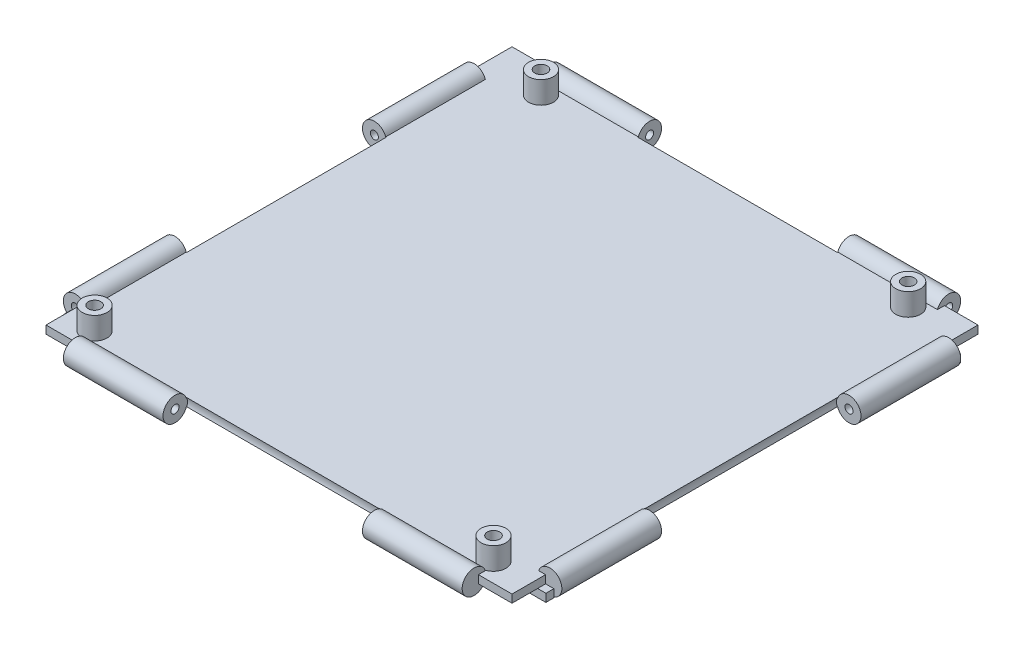
from build123d import *

# Parameters (mm, degrees)
SKETCH3_W                 = 97
SKETCH3_H                 = 97
BOSS_EXTRUDE2_DEPTH       = 1.6
SKETCH6_R                 = 2.4
BOSS_EXTRUDE3_DEPTH       = 25
SKETCH8_R                 = 2.4
BOSS_EXTRUDE4_DEPTH       = 25
BOSS_EXTRUDE5_START       = -25
SKETCH10_R                = 2.4
BOSS_EXTRUDE5_DEPTH       = 25
BOSS_EXTRUDE6_START       = -25
SKETCH11_R                = 2.4
BOSS_EXTRUDE6_DEPTH       = 25
SKETCH12_R                = 2.4
BOSS_EXTRUDE7_DEPTH       = 25
SKETCH13_R                = 2.4
BOSS_EXTRUDE8_DEPTH       = 25
BOSS_EXTRUDE9_START       = -25
SKETCH15_R                = 2.4
BOSS_EXTRUDE9_DEPTH       = 25
BOSS_EXTRUDE10_START      = -25
SKETCH16_R                = 2.4
BOSS_EXTRUDE10_DEPTH      = 25
SKETCH24_W                = 4.8
SKETCH24_H                = 5.548100674
CUT_EXTRUDE6_DEPTH        = 3.3
SKETCH25_W                = 4.8
SKETCH25_H                = 4.8
CUT_EXTRUDE7_DEPTH        = 3.3
SKETCH27_W                = 4.8
SKETCH27_H                = 5.15761508
CUT_EXTRUDE8_DEPTH        = 3.3
SKETCH28_W                = 4.8
SKETCH28_H                = 4.8
CUT_EXTRUDE9_DEPTH        = 6
SKETCH29_W                = 4.8
SKETCH29_H                = 5.426654508
CUT_EXTRUDE10_DEPTH       = 3.3
SKETCH30_W                = 5.09884484
SKETCH30_H                = 4.8
CUT_EXTRUDE11_DEPTH       = 3.3
SKETCH31_W                = 4.8
SKETCH31_H                = 5.480877926
CUT_EXTRUDE12_DEPTH       = 3.3
SKETCH32_W                = 4.987524697
SKETCH32_H                = 4.8
CUT_EXTRUDE13_DEPTH       = 3.3
BOSS_EXTRUDE11_START      = 1
SKETCH38_R                = 2.4
BOSS_EXTRUDE11_DEPTH      = 1
SKETCH39_R                = 2.4
BOSS_EXTRUDE12_DEPTH      = 1
BOSS_EXTRUDE13_START      = 1
SKETCH42_R                = 2.4
BOSS_EXTRUDE13_DEPTH      = 1
SKETCH43_R                = 2.4
BOSS_EXTRUDE14_DEPTH      = 1
BOSS_EXTRUDE15_START      = 1
SKETCH44_R                = 2.4
BOSS_EXTRUDE15_DEPTH      = 1
SKETCH45_R                = 2.4
BOSS_EXTRUDE16_DEPTH      = 1
BOSS_EXTRUDE17_START      = 1
SKETCH46_R                = 2.4
BOSS_EXTRUDE17_DEPTH      = 1
SKETCH47_R                = 2.4
BOSS_EXTRUDE18_DEPTH      = 1
CUT_EXTRUDE24_DEPTH       = 5.2
CUT_EXTRUDE25_DEPTH       = 5.2
CUT_EXTRUDE26_DEPTH       = 5.2
CUT_EXTRUDE27_DEPTH       = 5.2
CUT_EXTRUDE29_DEPTH       = 5.2
CUT_EXTRUDE30_DEPTH       = 5.2
CUT_EXTRUDE31_DEPTH       = 5.2
CUT_EXTRUDE32_DEPTH       = 5.2
SKETCH81_W                = 1.5372583
SKETCH81_H                = 1.5372583
BOSS_EXTRUDE21_DEPTH      = 1.6
SKETCH82_W                = 1.5372583
SKETCH82_H                = 1.5372583
BOSS_EXTRUDE22_DEPTH      = 1.6
SKETCH83_W                = 1.5372583
SKETCH83_H                = 1.5372583
BOSS_EXTRUDE23_DEPTH      = 1.6
SKETCH84_W                = 1.5372583
SKETCH84_H                = 1.5372583
BOSS_EXTRUDE24_DEPTH      = 1.6
SKETCH87_R                = 2.4
BOSS_EXTRUDE25_DEPTH      = 2.5
BOSS_EXTRUDE26_START      = 2.5
SKETCH88_R                = 2.4
BOSS_EXTRUDE26_DEPTH      = 2.5
SKETCH91_R                = 2.5
CUT_EXTRUDE33_DEPTH       = 40
BOSS_EXTRUDE27_START      = 2.5
SKETCH93_R                = 2.4
BOSS_EXTRUDE27_DEPTH      = 2.5
SKETCH94_R                = 2.4
BOSS_EXTRUDE28_DEPTH      = 2.5
SKETCH97_R                = 2.5
CUT_EXTRUDE34_DEPTH       = 40
BOSS_EXTRUDE29_START      = 2.5
SKETCH98_R                = 2.4
BOSS_EXTRUDE29_DEPTH      = 2.5
SKETCH99_R                = 2.4
BOSS_EXTRUDE30_DEPTH      = 2.5
SKETCH100_R               = 2.5
CUT_EXTRUDE35_DEPTH       = 40
SKETCH101_R               = 2.4
BOSS_EXTRUDE31_DEPTH      = 2.5
BOSS_EXTRUDE32_START      = 2.5
SKETCH102_R               = 2.4
BOSS_EXTRUDE32_DEPTH      = 2.5
SKETCH104_R               = 2.5
CUT_EXTRUDE36_DEPTH       = 40
SKETCH105_R               = 0.81
CUT_EXTRUDE37_DEPTH       = 78.5
SKETCH106_R               = 0.81
CUT_EXTRUDE38_DEPTH       = 78.5
SKETCH107_R               = 0.81
CUT_EXTRUDE39_DEPTH       = 78.5
SKETCH108_R               = 0.81
CUT_EXTRUDE40_DEPTH       = 78.5
CUT_EXTRUDE47_DEPTH       = 20
CUT_EXTRUDE48_DEPTH       = 20
CUT_EXTRUDE49_DEPTH       = 20
CUT_EXTRUDE50_DEPTH       = 20
SKETCH139_R               = 15
BOSS_EXTRUDE40_DEPTH      = 1.6
SKETCH140_R               = 5
CUT_EXTRUDE51_DEPTH       = 1.6
FILLET7_R                 = 2
CUT_EXTRUDE41_DEPTH       = 1.6
CUT_EXTRUDE42_DEPTH       = 1.6
CUT_EXTRUDE43_DEPTH       = 1.6
CUT_EXTRUDE44_DEPTH       = 1.6
SKETCH123_R               = 15
BOSS_EXTRUDE35_DEPTH      = 1.6
SKETCH124_R               = 5
CUT_EXTRUDE45_DEPTH       = 1.6
FILLET4_R                 = 2
SKETCH144_W               = 6.7372583
SKETCH144_H               = 1.6
BOSS_EXTRUDE42_DEPTH      = 1.6
SKETCH145_W               = 8.3372583
SKETCH145_H               = 1.6
BOSS_EXTRUDE43_DEPTH      = 1.6
SKETCH147_W               = 8.4
SKETCH147_H               = 1.6
BOSS_EXTRUDE44_DEPTH      = 1.6
SKETCH149_W               = 8.4
SKETCH149_H               = 1.6
BOSS_EXTRUDE45_DEPTH      = 1.6
SKETCH150_W               = 8.4
SKETCH150_H               = 1.6
BOSS_EXTRUDE46_DEPTH      = 1.6
SKETCH151_W               = 8.4
SKETCH151_H               = 1.6
BOSS_EXTRUDE47_DEPTH      = 1.6
FILLET12_R                = 1
SKETCH176_W               = 84.989213742
SKETCH176_H               = 89.710836726
BOSS_EXTRUDE58_DEPTH      = 1.6
SKETCH177_R               = 2.5
BOSS_EXTRUDE59_DEPTH      = 4.45
M3X0_5_TAPPED_HOLE1_D     = 2.5
M3X0_5_TAPPED_HOLE1_DEPTH = 4.45
M3X0_5_TAPPED_HOLE1_TIP   = 0.751075774


with BuildPart() as part:
    # Sketch3 → Boss-Extrude2 (new body)
    with BuildSketch(Plane(origin=(0, 0, 0), x_dir=(1, 0, 0), z_dir=(0, 1, 0))):
        Rectangle(SKETCH3_W, SKETCH3_H)
    extrude(amount=BOSS_EXTRUDE2_DEPTH)

    # Sketch6 → Boss-Extrude3 (add)
    with BuildSketch(Plane.XY.offset(48.5)):
        with Locations((-47.6, 0.8)):
            Circle(SKETCH6_R)
    extrude(amount=-BOSS_EXTRUDE3_DEPTH)

    # Sketch8 → Boss-Extrude4 (add)
    with BuildSketch(Plane.XY.offset(48.5)):
        with Locations((47.6, 0.8)):
            Circle(SKETCH8_R)
    extrude(amount=-BOSS_EXTRUDE4_DEPTH)

    # Sketch10 → Boss-Extrude5 (add)
    with BuildSketch(Plane(origin=(0, 0, -48.5), x_dir=(-1, 0, 0), z_dir=(0, 0, -1)).offset(BOSS_EXTRUDE5_START)):
        with Locations((-47.6, 0.8)):
            Circle(SKETCH10_R)
    extrude(amount=BOSS_EXTRUDE5_DEPTH)

    # Sketch11 → Boss-Extrude6 (add)
    with BuildSketch(Plane(origin=(0, 0, -48.5), x_dir=(-1, 0, 0), z_dir=(0, 0, -1)).offset(BOSS_EXTRUDE6_START)):
        with Locations((47.6, 0.8)):
            Circle(SKETCH11_R)
    extrude(amount=BOSS_EXTRUDE6_DEPTH)

    # Sketch12 → Boss-Extrude7 (add)
    with BuildSketch(Plane.ZY.offset(48.5)):
        with Locations((-47.6, 0.8)):
            Circle(SKETCH12_R)
    extrude(amount=-BOSS_EXTRUDE7_DEPTH)

    # Sketch13 → Boss-Extrude8 (add)
    with BuildSketch(Plane.ZY.offset(48.5)):
        with Locations((47.6, 0.8)):
            Circle(SKETCH13_R)
    extrude(amount=-BOSS_EXTRUDE8_DEPTH)

    # Sketch15 → Boss-Extrude9 (add)
    with BuildSketch(Plane(origin=(48.5, 0, 0), x_dir=(0, 0, -1), z_dir=(1, 0, 0)).offset(BOSS_EXTRUDE9_START)):
        with Locations((-47.6, 0.8)):
            Circle(SKETCH15_R)
    extrude(amount=BOSS_EXTRUDE9_DEPTH)

    # Sketch16 → Boss-Extrude10 (add)
    with BuildSketch(Plane(origin=(48.5, 0, 0), x_dir=(0, 0, -1), z_dir=(1, 0, 0)).offset(BOSS_EXTRUDE10_START)):
        with Locations((47.6, 0.8)):
            Circle(SKETCH16_R)
    extrude(amount=BOSS_EXTRUDE10_DEPTH)

    # Sketch24 → Cut-Extrude6 (cut)
    with BuildSketch(Plane.XY.offset(48.5)):
        with Locations((-47.6, 0.8)):
            Rectangle(SKETCH24_W, SKETCH24_H)
    extrude(amount=-CUT_EXTRUDE6_DEPTH, mode=Mode.SUBTRACT)

    # Sketch25 → Cut-Extrude7 (cut)
    with BuildSketch(Plane(origin=(0, 0, 48.5), x_dir=(-1, 0, 0), z_dir=(0, 0, -1))):
        with Locations((47.6, 0.8)):
            Rectangle(SKETCH25_W, SKETCH25_H)
    extrude(amount=-CUT_EXTRUDE7_DEPTH, mode=Mode.SUBTRACT)

    # Sketch27 → Cut-Extrude8 (cut)
    with BuildSketch(Plane(origin=(0, 0, -48.5), x_dir=(-1, 0, 0), z_dir=(0, 0, -1))):
        with Locations((47.6, 0.8)):
            Rectangle(SKETCH27_W, SKETCH27_H)
    extrude(amount=-CUT_EXTRUDE8_DEPTH, mode=Mode.SUBTRACT)

    # Sketch28 → Cut-Extrude9 (cut)
    with BuildSketch(Plane(origin=(0, 0, -45.2), x_dir=(-1, 0, 0), z_dir=(0, 0, -1))):
        with Locations((47.6, 0.8)):
            Rectangle(SKETCH28_W, SKETCH28_H)
    extrude(amount=CUT_EXTRUDE9_DEPTH, mode=Mode.SUBTRACT)

    # Sketch29 → Cut-Extrude10 (cut)
    with BuildSketch(Plane.XY.offset(48.5)):
        with Locations((47.6, 0.8)):
            Rectangle(SKETCH29_W, SKETCH29_H)
    extrude(amount=-CUT_EXTRUDE10_DEPTH, mode=Mode.SUBTRACT)

    # Sketch30 → Cut-Extrude11 (cut)
    with BuildSketch(Plane(origin=(0, 0, 48.5), x_dir=(-1, 0, 0), z_dir=(0, 0, -1))):
        with Locations((-47.74942242, 0.8)):
            Rectangle(SKETCH30_W, SKETCH30_H)
    extrude(amount=-CUT_EXTRUDE11_DEPTH, mode=Mode.SUBTRACT)

    # Sketch31 → Cut-Extrude12 (cut)
    with BuildSketch(Plane(origin=(0, 0, -48.5), x_dir=(-1, 0, 0), z_dir=(0, 0, -1))):
        with Locations((-47.6, 0.8)):
            Rectangle(SKETCH31_W, SKETCH31_H)
    extrude(amount=-CUT_EXTRUDE12_DEPTH, mode=Mode.SUBTRACT)

    # Sketch32 → Cut-Extrude13 (cut)
    with BuildSketch(Plane.XY.offset(-48.5)):
        with Locations((47.693762349, 0.8)):
            Rectangle(SKETCH32_W, SKETCH32_H)
    extrude(amount=-CUT_EXTRUDE13_DEPTH, mode=Mode.SUBTRACT)

    # Sketch38 → Boss-Extrude11 (add)
    with BuildSketch(Plane.XY.offset(-23.5).offset(BOSS_EXTRUDE11_START)):
        with Locations((-47.6, 0.8)):
            Circle(SKETCH38_R)
    extrude(amount=-BOSS_EXTRUDE11_DEPTH)

    # Sketch39 → Boss-Extrude12 (add)
    with BuildSketch(Plane(origin=(0, 0, 23.5), x_dir=(-1, 0, 0), z_dir=(0, 0, -1))):
        with Locations((47.6, 0.8)):
            Circle(SKETCH39_R)
    extrude(amount=BOSS_EXTRUDE12_DEPTH)

    # Sketch42 → Boss-Extrude13 (add)
    with BuildSketch(Plane.XY.offset(-23.5).offset(BOSS_EXTRUDE13_START)):
        with Locations((47.6, 0.8)):
            Circle(SKETCH42_R)
    extrude(amount=-BOSS_EXTRUDE13_DEPTH)

    # Sketch43 → Boss-Extrude14 (add)
    with BuildSketch(Plane(origin=(0, 0, 23.5), x_dir=(-1, 0, 0), z_dir=(0, 0, -1))):
        with Locations((-47.6, 0.8)):
            Circle(SKETCH43_R)
    extrude(amount=BOSS_EXTRUDE14_DEPTH)

    # Sketch44 → Boss-Extrude15 (add)
    with BuildSketch(Plane.ZY.offset(-23.5).offset(BOSS_EXTRUDE15_START)):
        with Locations((-47.6, 0.8)):
            Circle(SKETCH44_R)
    extrude(amount=-BOSS_EXTRUDE15_DEPTH)

    # Sketch45 → Boss-Extrude16 (add)
    with BuildSketch(Plane(origin=(-23.5, 0, 0), x_dir=(0, 0, -1), z_dir=(1, 0, 0))):
        with Locations((47.6, 0.8)):
            Circle(SKETCH45_R)
    extrude(amount=BOSS_EXTRUDE16_DEPTH)

    # Sketch46 → Boss-Extrude17 (add)
    with BuildSketch(Plane.ZY.offset(-23.5).offset(BOSS_EXTRUDE17_START)):
        with Locations((47.6, 0.8)):
            Circle(SKETCH46_R)
    extrude(amount=-BOSS_EXTRUDE17_DEPTH)

    # Sketch47 → Boss-Extrude18 (add)
    with BuildSketch(Plane(origin=(-23.5, 0, 0), x_dir=(0, 0, -1), z_dir=(1, 0, 0))):
        with Locations((-47.6, 0.8)):
            Circle(SKETCH47_R)
    extrude(amount=BOSS_EXTRUDE18_DEPTH)

    # Sketch69 → Cut-Extrude24 (cut)
    with BuildSketch(Plane.XY.offset(45.2)):
        Polygon((-45.3372583, 1.6), (-46.7372583, 1.6), (-46.7372583, 0), (-45.3372583, 0), (-45.3372583, -2.296346165), (-50.861781819, -2.296346165), (-50.861781819, 4.089099576), (-45.3372583, 4.089099576), align=None)
    extrude(amount=-CUT_EXTRUDE24_DEPTH, mode=Mode.SUBTRACT)

    # Sketch72 → Cut-Extrude25 (cut)
    with BuildSketch(Plane.XY.offset(45.2)):
        Polygon((45.3372583, 1.6), (46.7372583, 1.6), (46.7372583, 0), (45.3372583, 0), (45.3372583, -2.331961344), (51.56640404, -2.331961344), (51.56640404, 3.886760814), (45.3372583, 3.886760814), align=None)
    extrude(amount=-CUT_EXTRUDE25_DEPTH, mode=Mode.SUBTRACT)

    # Sketch74 → Cut-Extrude26 (cut)
    with BuildSketch(Plane(origin=(0, 0, -45.2), x_dir=(-1, 0, 0), z_dir=(0, 0, -1))):
        Polygon((-45.3372583, 1.6), (-46.7372583, 1.6), (-46.7372583, 0), (-45.3372583, 0), (-45.3372583, -2.152541816), (-50.402223677, -2.152541816), (-50.402223677, 3.951890312), (-45.3372583, 3.951890312), align=None)
    extrude(amount=-CUT_EXTRUDE26_DEPTH, mode=Mode.SUBTRACT)

    # Sketch75 → Cut-Extrude27 (cut)
    with BuildSketch(Plane(origin=(0, 0, -45.2), x_dir=(-1, 0, 0), z_dir=(0, 0, -1))):
        Polygon((45.3372583, 1.6), (46.7372583, 1.6), (46.7372583, 0), (45.3372583, 0), (45.3372583, -1.886407627), (51.292007853, -1.886407627), (51.292007853, 3.823835951), (45.3372583, 3.823835951), align=None)
    extrude(amount=-CUT_EXTRUDE27_DEPTH, mode=Mode.SUBTRACT)

    # Sketch77 → Cut-Extrude29 (cut)
    with BuildSketch(Plane.ZY.offset(45.2)):
        Polygon((-45.3372583, 1.6), (-45.3372583, 4.072789502), (-50.753871923, 4.072789502), (-50.753871923, -2.073669683), (-45.3372583, -2.073669683), (-45.3372583, 0), (-46.7372583, 0), (-46.7372583, 1.6), align=None)
    extrude(amount=-CUT_EXTRUDE29_DEPTH, mode=Mode.SUBTRACT)

    # Sketch78 → Cut-Extrude30 (cut)
    with BuildSketch(Plane.ZY.offset(45.2)):
        Polygon((45.3372583, 1.6), (45.3372583, 3.551844718), (50.698124542, 3.551844718), (50.698124542, -1.797720923), (45.3372583, -1.797720923), (45.3372583, 0), (46.7372583, 0), (46.7372583, 1.6), align=None)
    extrude(amount=-CUT_EXTRUDE30_DEPTH, mode=Mode.SUBTRACT)

    # Sketch79 → Cut-Extrude31 (cut)
    with BuildSketch(Plane(origin=(45.2, 0, 0), x_dir=(0, 0, -1), z_dir=(1, 0, 0))):
        Polygon((-45.3372583, 1.6), (-45.3372583, 4.000281976), (-50.784286874, 4.000281976), (-50.784286874, -1.851902168), (-45.3372583, -1.851902168), (-45.3372583, 0), (-46.7372583, 0), (-46.7372583, 1.6), align=None)
    extrude(amount=-CUT_EXTRUDE31_DEPTH, mode=Mode.SUBTRACT)

    # Sketch80 → Cut-Extrude32 (cut)
    with BuildSketch(Plane(origin=(45.2, 0, 0), x_dir=(0, 0, -1), z_dir=(1, 0, 0))):
        Polygon((45.3372583, 1.6), (45.3372583, 3.793833644), (50.51960102, 3.793833644), (50.51960102, -2.045122916), (45.3372583, -2.045122916), (45.3372583, 0), (46.7372583, 0), (46.7372583, 1.6), align=None)
    extrude(amount=-CUT_EXTRUDE32_DEPTH, mode=Mode.SUBTRACT)

    # Sketch81 → Boss-Extrude21 (add)
    with BuildSketch(Plane(origin=(0, 1.6, 0), x_dir=(1, 0, 0), z_dir=(0, 1, 0))):
        with Locations((-45.96862915, 45.96862915)):
            Rectangle(SKETCH81_W, SKETCH81_H)
    extrude(amount=-BOSS_EXTRUDE21_DEPTH)

    # Sketch82 → Boss-Extrude22 (add)
    with BuildSketch(Plane(origin=(0, 1.6, 0), x_dir=(1, 0, 0), z_dir=(0, 1, 0))):
        with Locations((45.96862915, 45.96862915)):
            Rectangle(SKETCH82_W, SKETCH82_H)
    extrude(amount=-BOSS_EXTRUDE22_DEPTH)

    # Sketch83 → Boss-Extrude23 (add)
    with BuildSketch(Plane(origin=(0, 1.6, 0), x_dir=(1, 0, 0), z_dir=(0, 1, 0))):
        with Locations((-45.96862915, -45.96862915)):
            Rectangle(SKETCH83_W, SKETCH83_H)
    extrude(amount=-BOSS_EXTRUDE23_DEPTH)

    # Sketch84 → Boss-Extrude24 (add)
    with BuildSketch(Plane(origin=(0, 1.6, 0), x_dir=(1, 0, 0), z_dir=(0, 1, 0))):
        with Locations((45.96862915, -45.96862915)):
            Rectangle(SKETCH84_W, SKETCH84_H)
    extrude(amount=-BOSS_EXTRUDE24_DEPTH)

    # Sketch87 → Boss-Extrude25 (add)
    with BuildSketch(Plane(origin=(-22.5, 0, 0), x_dir=(0, 0, -1), z_dir=(1, 0, 0))):
        with Locations((-47.6, 0.8)):
            Circle(SKETCH87_R)
    extrude(amount=BOSS_EXTRUDE25_DEPTH)

    # Sketch88 → Boss-Extrude26 (add)
    with BuildSketch(Plane.ZY.offset(-22.5).offset(BOSS_EXTRUDE26_START)):
        with Locations((47.6, 0.8)):
            Circle(SKETCH88_R)
    extrude(amount=-BOSS_EXTRUDE26_DEPTH)

    # Sketch91 → Cut-Extrude33 (cut)
    with BuildSketch(Plane(origin=(-20, 0, 0), x_dir=(0, 0, -1), z_dir=(1, 0, 0))):
        with Locations((-47.6, 0.8)):
            Circle(SKETCH91_R)
    extrude(amount=CUT_EXTRUDE33_DEPTH, mode=Mode.SUBTRACT)

    # Sketch93 → Boss-Extrude27 (add)
    with BuildSketch(Plane.XY.offset(-22.5).offset(BOSS_EXTRUDE27_START)):
        with Locations((-47.6, 0.8)):
            Circle(SKETCH93_R)
    extrude(amount=-BOSS_EXTRUDE27_DEPTH)

    # Sketch94 → Boss-Extrude28 (add)
    with BuildSketch(Plane(origin=(0, 0, 22.5), x_dir=(-1, 0, 0), z_dir=(0, 0, -1))):
        with Locations((47.6, 0.8)):
            Circle(SKETCH94_R)
    extrude(amount=BOSS_EXTRUDE28_DEPTH)

    # Sketch97 → Cut-Extrude34 (cut)
    with BuildSketch(Plane.XY.offset(-20)):
        with Locations((-47.6, 0.8)):
            Circle(SKETCH97_R)
    extrude(amount=CUT_EXTRUDE34_DEPTH, mode=Mode.SUBTRACT)

    # Sketch98 → Boss-Extrude29 (add)
    with BuildSketch(Plane.XY.offset(-22.5).offset(BOSS_EXTRUDE29_START)):
        with Locations((47.6, 0.8)):
            Circle(SKETCH98_R)
    extrude(amount=-BOSS_EXTRUDE29_DEPTH)

    # Sketch99 → Boss-Extrude30 (add)
    with BuildSketch(Plane(origin=(0, 0, 22.5), x_dir=(-1, 0, 0), z_dir=(0, 0, -1))):
        with Locations((-47.6, 0.8)):
            Circle(SKETCH99_R)
    extrude(amount=BOSS_EXTRUDE30_DEPTH)

    # Sketch100 → Cut-Extrude35 (cut)
    with BuildSketch(Plane.XY.offset(-20)):
        with Locations((47.6, 0.8)):
            Circle(SKETCH100_R)
    extrude(amount=CUT_EXTRUDE35_DEPTH, mode=Mode.SUBTRACT)

    # Sketch101 → Boss-Extrude31 (add)
    with BuildSketch(Plane(origin=(-22.5, 0, 0), x_dir=(0, 0, -1), z_dir=(1, 0, 0))):
        with Locations((47.6, 0.8)):
            Circle(SKETCH101_R)
    extrude(amount=BOSS_EXTRUDE31_DEPTH)

    # Sketch102 → Boss-Extrude32 (add)
    with BuildSketch(Plane.ZY.offset(-22.5).offset(BOSS_EXTRUDE32_START)):
        with Locations((-47.6, 0.8)):
            Circle(SKETCH102_R)
    extrude(amount=-BOSS_EXTRUDE32_DEPTH)

    # Sketch104 → Cut-Extrude36 (cut)
    with BuildSketch(Plane(origin=(-20, 0, 0), x_dir=(0, 0, -1), z_dir=(1, 0, 0))):
        with Locations((47.6, 0.8)):
            Circle(SKETCH104_R)
    extrude(amount=CUT_EXTRUDE36_DEPTH, mode=Mode.SUBTRACT)

    # Sketch105 → Cut-Extrude37 (cut)
    with BuildSketch(Plane.XY.offset(40)):
        with Locations((-47.6, 0.8)):
            Circle(SKETCH105_R)
    extrude(amount=-CUT_EXTRUDE37_DEPTH, mode=Mode.SUBTRACT)

    # Sketch106 → Cut-Extrude38 (cut)
    with BuildSketch(Plane.ZY.offset(40)):
        with Locations((47.6, 0.8)):
            Circle(SKETCH106_R)
    extrude(amount=-CUT_EXTRUDE38_DEPTH, mode=Mode.SUBTRACT)

    # Sketch107 → Cut-Extrude39 (cut)
    with BuildSketch(Plane(origin=(40, 0, 0), x_dir=(0, 0, -1), z_dir=(1, 0, 0))):
        with Locations((47.6, 0.8)):
            Circle(SKETCH107_R)
    extrude(amount=-CUT_EXTRUDE39_DEPTH, mode=Mode.SUBTRACT)

    # Sketch108 → Cut-Extrude40 (cut)
    with BuildSketch(Plane(origin=(0, 0, -40), x_dir=(-1, 0, 0), z_dir=(0, 0, -1))):
        with Locations((-47.6, 0.8)):
            Circle(SKETCH108_R)
    extrude(amount=-CUT_EXTRUDE40_DEPTH, mode=Mode.SUBTRACT)

    # Sketch135 → Cut-Extrude47 (cut)
    with BuildSketch(Plane(origin=(0, 1.6, 0), x_dir=(1, 0, 0), z_dir=(0, 1, 0))):
        Polygon((28.160388332, 35.231456144), (0, 7.071067812), (-28.160388332, 35.231456144), align=None)
    extrude(amount=-CUT_EXTRUDE47_DEPTH, mode=Mode.SUBTRACT)

    # Sketch136 → Cut-Extrude48 (cut)
    with BuildSketch(Plane(origin=(0, 1.6, 0), x_dir=(1, 0, 0), z_dir=(0, 1, 0))):
        Polygon((-28.160388332, -35.231456144), (0, -7.071067812), (28.160388332, -35.231456144), align=None)
    extrude(amount=-CUT_EXTRUDE48_DEPTH, mode=Mode.SUBTRACT)

    # Sketch137 → Cut-Extrude49 (cut)
    with BuildSketch(Plane(origin=(0, 1.6, 0), x_dir=(1, 0, 0), z_dir=(0, 1, 0))):
        Polygon((35.231456144, 28.160388332), (7.071067812, 0), (35.231456144, -28.160388332), align=None)
    extrude(amount=-CUT_EXTRUDE49_DEPTH, mode=Mode.SUBTRACT)

    # Sketch138 → Cut-Extrude50 (cut)
    with BuildSketch(Plane(origin=(0, 1.6, 0), x_dir=(1, 0, 0), z_dir=(0, 1, 0))):
        Polygon((-35.231456144, 28.160388332), (-7.071067812, 0), (-35.231456144, -28.160388332), align=None)
    extrude(amount=-CUT_EXTRUDE50_DEPTH, mode=Mode.SUBTRACT)

    # Sketch139 → Boss-Extrude40 (add)
    with BuildSketch(Plane(origin=(0, 1.6, 0), x_dir=(1, 0, 0), z_dir=(0, 1, 0))):
        Circle(SKETCH139_R)
    extrude(amount=-BOSS_EXTRUDE40_DEPTH)

    # Sketch140 → Cut-Extrude51 (cut)
    with BuildSketch(Plane(origin=(0, 1.6, 0), x_dir=(1, 0, 0), z_dir=(0, 1, 0))):
        Circle(SKETCH140_R)
    extrude(amount=-CUT_EXTRUDE51_DEPTH, mode=Mode.SUBTRACT)

    # Fillet7
    fillet7_edges = [part.edges().sort_by_distance(p)[0] for p in [
        (28.160388332, 0.8, -35.231456144),
        (35.231456144, 0.8, -28.160388332),
        (35.231456144, 0.8, 28.160388332),
        (28.160388332, 0.8, 35.231456144),
        (-28.160388332, 0.8, 35.231456144),
        (-13.535533906, 0.8, -6.464466094),
        (-13.535533906, 0.8, 6.464466094),
        (-35.231456144, 0.8, 28.160388332),
        (6.464466094, 0.8, -13.535533906),
        (-6.464466094, 0.8, -13.535533906),
        (13.535533906, 0.8, 6.464466094),
        (13.535533906, 0.8, -6.464466094),
        (-6.464466094, 0.8, 13.535533906),
        (6.464466094, 0.8, 13.535533906),
        (-35.231456144, 0.8, -28.160388332),
        (-28.160388332, 0.8, -35.231456144),
    ]]
    fillet(fillet7_edges, radius=FILLET7_R)

    # Sketch119 → Cut-Extrude41 (cut)
    with BuildSketch(Plane(origin=(0, 1.6, 0), x_dir=(1, 0, 0), z_dir=(0, 1, 0))):
        Polygon((-28.160388332, 35.231456144), (28.160388332, 35.231456144), (0, 7.071067812), align=None)
    extrude(amount=-CUT_EXTRUDE41_DEPTH, mode=Mode.SUBTRACT)

    # Sketch120 → Cut-Extrude42 (cut)
    with BuildSketch(Plane(origin=(0, 1.6, 0), x_dir=(1, 0, 0), z_dir=(0, 1, 0))):
        Polygon((-28.160388332, -35.231456144), (28.160388332, -35.231456144), (0, -7.071067812), align=None)
    extrude(amount=-CUT_EXTRUDE42_DEPTH, mode=Mode.SUBTRACT)

    # Sketch121 → Cut-Extrude43 (cut)
    with BuildSketch(Plane(origin=(0, 1.6, 0), x_dir=(1, 0, 0), z_dir=(0, 1, 0))):
        Polygon((-35.231456144, 28.160388332), (-35.231456144, -28.160388332), (-7.071067812, 0), align=None)
    extrude(amount=-CUT_EXTRUDE43_DEPTH, mode=Mode.SUBTRACT)

    # Sketch122 → Cut-Extrude44 (cut)
    with BuildSketch(Plane(origin=(0, 1.6, 0), x_dir=(1, 0, 0), z_dir=(0, 1, 0))):
        Polygon((35.231456144, 28.160388332), (35.231456144, -28.160388332), (7.071067812, 0), align=None)
    extrude(amount=-CUT_EXTRUDE44_DEPTH, mode=Mode.SUBTRACT)

    # Sketch123 → Boss-Extrude35 (add)
    with BuildSketch(Plane(origin=(0, 1.6, 0), x_dir=(1, 0, 0), z_dir=(0, 1, 0))):
        Circle(SKETCH123_R)
    extrude(amount=-BOSS_EXTRUDE35_DEPTH)

    # Sketch124 → Cut-Extrude45 (cut)
    with BuildSketch(Plane(origin=(0, 1.6, 0), x_dir=(1, 0, 0), z_dir=(0, 1, 0))):
        Circle(SKETCH124_R)
    extrude(amount=-CUT_EXTRUDE45_DEPTH, mode=Mode.SUBTRACT)

    # Fillet4
    fillet4_edges = [part.edges().sort_by_distance(p)[0] for p in [
        (35.231456144, 0.8, 28.160388332),
        (35.231456144, 0.8, -28.160388332),
        (-6.464466094, 0.8, 13.535533906),
        (6.464466094, 0.8, 13.535533906),
        (28.160388332, 0.8, 35.231456144),
        (13.535533906, 0.8, -6.464466094),
        (13.535533906, 0.8, 6.464466094),
        (-28.160388332, 0.8, 35.231456144),
        (-13.535533906, 0.8, 6.464466094),
        (-13.535533906, 0.8, -6.464466094),
        (28.160388332, 0.8, -35.231456144),
        (-28.160388332, 0.8, -35.231456144),
        (6.464466094, 0.8, -13.535533906),
        (-6.464466094, 0.8, -13.535533906),
        (-35.231456144, 0.8, 28.160388332),
        (-35.231456144, 0.8, -28.160388332),
    ]]
    fillet(fillet4_edges, radius=FILLET4_R)

    # Sketch144 → Boss-Extrude42 (add)
    with BuildSketch(Plane(origin=(0, 0, -46.7372583), x_dir=(-1, 0, 0), z_dir=(0, 0, -1))):
        with Locations((43.36862915, 0.8)):
            Rectangle(SKETCH144_W, SKETCH144_H)
    extrude(amount=BOSS_EXTRUDE42_DEPTH)

    # Sketch145 → Boss-Extrude43 (add)
    with BuildSketch(Plane.ZY.offset(46.7372583)):
        with Locations((-44.16862915, 0.8)):
            Rectangle(SKETCH145_W, SKETCH145_H)
    extrude(amount=BOSS_EXTRUDE43_DEPTH)

    # Sketch147 → Boss-Extrude44 (add)
    with BuildSketch(Plane.XZ):
        with Locations((-44.2, -40.8)):
            Rectangle(SKETCH147_W, SKETCH147_H)
    extrude(amount=BOSS_EXTRUDE44_DEPTH)

    # Sketch149 → Boss-Extrude45 (add)
    with BuildSketch(Plane.XZ):
        with Locations((-44.2, 40.8)):
            Rectangle(SKETCH149_W, SKETCH149_H)
    extrude(amount=BOSS_EXTRUDE45_DEPTH)

    # Sketch150 → Boss-Extrude46 (add)
    with BuildSketch(Plane.XZ):
        with Locations((44.2, -40.8)):
            Rectangle(SKETCH150_W, SKETCH150_H)
    extrude(amount=BOSS_EXTRUDE46_DEPTH)

    # Sketch151 → Boss-Extrude47 (add)
    with BuildSketch(Plane.XZ):
        with Locations((44.2, 40.8)):
            Rectangle(SKETCH151_W, SKETCH151_H)
    extrude(amount=BOSS_EXTRUDE47_DEPTH)

    # Fillet12
    fillet12_edges = [part.edges().sort_by_distance(p)[0] for p in [
        (40, -0.8, 40),
        (40, -0.8, -40),
        (-40, -0.8, -40),
        (-40, -0.8, 40),
    ]]
    fillet(fillet12_edges, radius=FILLET12_R)

    # Sketch176 → Boss-Extrude58 (add)
    with BuildSketch(Plane.XZ):
        Rectangle(SKETCH176_W, SKETCH176_H)
    extrude(amount=-BOSS_EXTRUDE58_DEPTH)

    # Sketch177 → Boss-Extrude59 (add)
    with BuildSketch(Plane(origin=(0, 1.6, 0), x_dir=(1, 0, 0), z_dir=(0, 1, 0))):
        with Locations((-40.843256418, -42.878078845)):
            Circle(SKETCH177_R)
        with Locations((39.166743582, -42.878078845)):
            Circle(SKETCH177_R)
        with Locations((-37.033256418, 42.846921155)):
            Circle(SKETCH177_R)
        with Locations((36.626743582, 42.846921155)):
            Circle(SKETCH177_R)
    extrude(amount=BOSS_EXTRUDE59_DEPTH)

    # M3x0.5 Tapped Hole1
    with Locations(Plane(origin=(0, 6.05, 0), x_dir=(1, 0, 0), z_dir=(0, 1, 0))):
        with Locations((-40.843256418, -42.878078845), (39.166743582, -42.878078845), (36.626743582, 42.846921155), (-37.033256418, 42.846921155)):
            Hole(M3X0_5_TAPPED_HOLE1_D / 2, depth=M3X0_5_TAPPED_HOLE1_DEPTH)
            with Locations((0, 0, -(M3X0_5_TAPPED_HOLE1_DEPTH + M3X0_5_TAPPED_HOLE1_TIP / 2))):  # 118° drill point
                Cone(0, M3X0_5_TAPPED_HOLE1_D / 2, M3X0_5_TAPPED_HOLE1_TIP, mode=Mode.SUBTRACT)


solid = part.part
